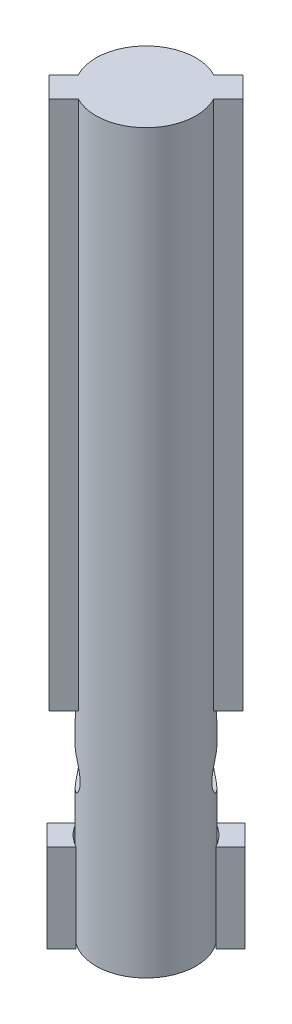
from build123d import *

# Parameters (mm, degrees)
SKETCH1_R             = 1.7
BOSS_EXTRUDE1_DEPTH   = 12.5
BOSS_EXTRUDE2_DEPTH   = 18
BOSS_EXTRUDE3_DEPTH   = 3
BOSS_EXTRUDE3_2_DEPTH = 3
SKETCH9_W             = 0.625
SKETCH9_H             = 5.201858664


with BuildPart() as part:
    # Sketch1 → Boss-Extrude1 (new, symmetric)
    with BuildSketch(Plane(origin=(0, 0, 0), x_dir=(1, 0, 0), z_dir=(0, 1, 0))):
        Circle(SKETCH1_R)
    extrude(amount=BOSS_EXTRUDE1_DEPTH, both=True)

    # Sketch2 → Boss-Extrude2 (add)
    with BuildSketch(Plane(origin=(0, 12.5, 0), x_dir=(1, 0, 0), z_dir=(0, 1, 0))):
        with BuildLine():
            Line((-0.795359139, -1.50246592), (-1.290333886, -1.997440667))
            Line((-1.290333886, -1.997440667), (-1.997440667, -1.290333886))
            Line((-1.997440667, -1.290333886), (-1.50246592, -0.795359139))
            ThreePointArc((-1.50246592, -0.795359139), (-1.202081528, -1.202081528), (-0.795359139, -1.50246592))
        make_face()
        with BuildLine():
            Line((1.290333886, 1.997440667), (0.795359139, 1.50246592))
            ThreePointArc((0.795359139, 1.50246592), (1.202081528, 1.202081528), (1.50246592, 0.795359139))
            Line((1.50246592, 0.795359139), (1.997440667, 1.290333886))
            Line((1.997440667, 1.290333886), (1.290333886, 1.997440667))
        make_face()
    extrude(amount=-BOSS_EXTRUDE2_DEPTH)

    # Sketch9 → M1.6 Tapped Hole3 (revolve, cut)
    with BuildSketch(Plane(origin=(-1.643887276, -7.5, 1.643887276), x_dir=(0.7071067811865568, 0, 0.7071067811865384), z_dir=(0, 1, 0))):
        with Locations((0.3125, 2.600929332)):
            Rectangle(SKETCH9_W, SKETCH9_H)
    revolve(axis=Axis((-6.134015337, -7.5, 6.134015337), (0.7071067811865384, 0, -0.7071067811865568)), mode=Mode.SUBTRACT)


with BuildPart() as body_2:
    # Sketch7 → Boss-Extrude3 (new body)
    with BuildSketch(Plane.XZ.offset(12.5)):
        with BuildLine():
            Line((2.03438226, -1.327275479), (1.539407513, -0.832300732))
            ThreePointArc((1.539407513, -0.832300732), (1.237436867, -1.237436867), (0.832300732, -1.539407513))
            Line((0.832300732, -1.539407513), (1.327275479, -2.03438226))
            Line((1.327275479, -2.03438226), (2.03438226, -1.327275479))
        make_face()
    extrude(amount=-BOSS_EXTRUDE3_DEPTH)


with BuildPart() as body_3:
    # Sketch7 → Boss-Extrude3 2 (new body)
    with BuildSketch(Plane.XZ.offset(12.5)):
        with BuildLine():
            Line((-2.03438226, 1.327275479), (-1.539407513, 0.832300732))
            ThreePointArc((-1.539407513, 0.832300732), (-1.237436867, 1.237436867), (-0.832300732, 1.539407513))
            Line((-0.832300732, 1.539407513), (-1.327275479, 2.03438226))
            Line((-1.327275479, 2.03438226), (-2.03438226, 1.327275479))
        make_face()
    extrude(amount=-BOSS_EXTRUDE3_2_DEPTH)


solid = Compound([part.part, body_2.part, body_3.part])
